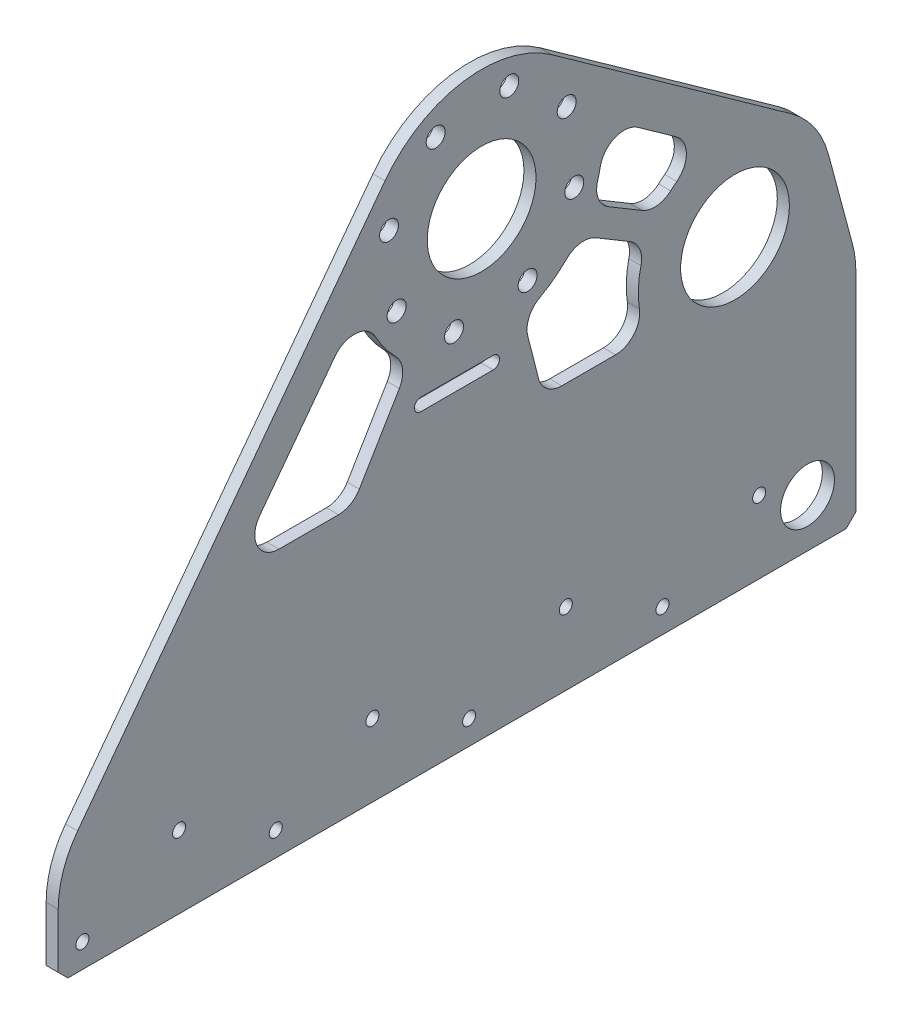
from build123d import *

# Parameters (mm, degrees)
SKETCH1_R                    = 14.2875
BOSS_EXTRUDE1_DEPTH          = 3.175
F_10_CLEARANCE_HOLE1_D       = 4.9784
SKETCH9_R                    = 7.0739
CUT_EXTRUDE1_DEPTH           = 246.051592782
FILLET1_R                    = 6.35
F_1_8_0_135_DIAMETER_HOLE1_D = 3.429
CHAMFER1_SIZE                = 2.54
CUT_EXTRUDE2_DEPTH           = 246.051592782


with BuildPart() as part:
    # Sketch1 → Boss-Extrude1 (new body)
    with BuildSketch(Plane(origin=(0, 0, 0), x_dir=(0, 0, -1), z_dir=(1, 0, 0))):
        with BuildLine():
            Line((0, -25.4), (0, 31.863977372))
            ThreePointArc((0, 31.863977372), (-0.217300521, 35.179342654), (-0.865484012, 38.437981118))
            Line((-0.865484012, 38.437981118), (-7.215484012, 62.136503746))
            ThreePointArc((-7.215484012, 62.136503746), (-10.879443925, 70.039374287), (-16.998077198, 76.239559115))
            Line((-16.998077198, 76.239559115), (-79.87164219, 121.096323894))
            ThreePointArc((-79.87164219, 121.096323894), (-103.165558841, 126.626759813), (-123.699445398, 114.31612306))
            Line((-123.699445398, 114.31612306), (-204.460319765, 6.777271443))
            ThreePointArc((-204.460319765, 6.777271443), (-208.244004669, -0.435792492), (-209.55, -8.475627004))
            Line((-209.55, -8.475627004), (-209.55, -25.4))
            Line((-209.55, -25.4), (0, -25.4))
        make_face()
        with Locations((-31.75, 55.5625)):
            Circle(SKETCH1_R, mode=Mode.SUBTRACT)
        with Locations((-98.311545692, 95.25)):
            Circle(SKETCH1_R, mode=Mode.SUBTRACT)
    extrude(amount=BOSS_EXTRUDE1_DEPTH)

    # #10 Clearance Hole1 (through all)
    with Locations(Plane(origin=(3.175, 0, 0), x_dir=(0, 0, -1), z_dir=(1, 0, 0))):
        with Locations((-91.050282965, 119.589968439), (-75.966100841, 107.326468623), (-73.971577253, 87.988737273), (-86.235077069, 72.904555149), (-105.572808419, 70.910031561), (-120.656990543, 83.173531377), (-122.651514131, 102.511262727), (-110.388014315, 117.595444851)):
            Hole(F_10_CLEARANCE_HOLE1_D / 2)

    # Sketch9 → Cut-Extrude1 (cut, through all)
    with BuildSketch(Plane(origin=(3.175, 0, 0), x_dir=(0, 0, -1), z_dir=(1, 0, 0))):
        with Locations((-12.7, -12.7)):
            Circle(SKETCH9_R)
        with BuildLine():
            Line((-164.256457276, 44.45), (-129.69901081, 90.465699272))
            ThreePointArc((-129.69901081, 90.465699272), (-125.509192978, 78.868593403), (-117.217117013, 69.742317372))
            Line((-117.217117013, 69.742317372), (-132.297729028, 44.45))
            Line((-132.297729028, 44.45), (-164.256457276, 44.45))
        make_face()
        with BuildLine():
            Line((-66.945646017, 100.173701616), (-38.671072347, 80.001377993))
            ThreePointArc((-38.671072347, 80.001377993), (-45.921454308, 76.641633825), (-51.769190034, 71.195542903))
            Line((-51.769190034, 71.195542903), (-69.551855526, 81.798504859))
            ThreePointArc((-69.551855526, 81.798504859), (-66.876157951, 90.791424263), (-66.945646017, 100.173701616))
        make_face()
        with BuildLine():
            Line((-55.021197572, 65.741466723), (-72.803863064, 76.344428679))
            ThreePointArc((-72.803863064, 76.344428679), (-79.339445973, 69.791761015), (-87.487017182, 65.402184627))
            Line((-87.487017182, 65.402184627), (-82.187487541, 44.45))
            Line((-82.187487541, 44.45), (-54.59014763, 44.45))
            ThreePointArc((-54.59014763, 44.45), (-57.144796276, 55.048377342), (-55.021197572, 65.741466723))
        make_face()
    extrude(amount=-CUT_EXTRUDE1_DEPTH, mode=Mode.SUBTRACT)

    # Fillet1
    fillet1_edges = [part.edges().sort_by_distance(p)[0] for p in [
        (1.5875, 100.173701616, 66.945646017),
        (1.5875, 71.195542903, 51.769190034),
        (1.5875, 81.798504859, 69.551855526),
        (1.5875, 80.001377993, 38.671072347),
        (1.5875, 76.344428679, 72.803863064),
        (1.5875, 65.741466723, 55.021197572),
        (1.5875, 44.45, 82.187487541),
        (1.5875, 65.402184627, 87.487017182),
        (1.5875, 44.45, 54.59014763),
        (1.5875, 44.45, 164.256457276),
        (1.5875, 90.465699272, 129.69901081),
        (1.5875, 69.742317372, 117.217117013),
        (1.5875, 44.45, 132.297729028),
    ]]
    fillet(fillet1_edges, radius=FILLET1_R)

    # 1/8 (0.135) Diameter Hole1 (through all)
    with Locations(Plane(origin=(3.175, 0, 0), x_dir=(0, 0, -1), z_dir=(1, 0, 0))):
        with Locations((-177.8, -6.35), (-152.4, -19.05), (-127, -6.35), (-101.6, -19.05), (-76.2, -6.35), (-50.8, -19.05), (-25.4, -6.35), (-203.2, -19.05)):
            Hole(F_1_8_0_135_DIAMETER_HOLE1_D / 2)

    # Chamfer1
    chamfer1_edges = [part.edges().sort_by_distance(p)[0] for p in [
        (1.5875, -25.4, 0),
        (1.5875, -25.4, 209.55),
    ]]
    chamfer(chamfer1_edges, length=CHAMFER1_SIZE)

    # Sketch12 → Cut-Extrude2 (cut, through all)
    with BuildSketch(Plane(origin=(3.175, 0, 0), x_dir=(0, 0, -1), z_dir=(1, 0, 0))):
        with BuildLine():
            Line((-114.315028797, 60.3885), (-95.265028797, 60.3885))
            ThreePointArc((-95.265028797, 60.3885), (-93.614028797, 58.7375), (-95.265028797, 57.0865))
            Line((-95.265028797, 57.0865), (-114.315028797, 57.0865))
            ThreePointArc((-114.315028797, 57.0865), (-115.966028797, 58.7375), (-114.315028797, 60.3885))
        make_face()
    extrude(amount=-CUT_EXTRUDE2_DEPTH, mode=Mode.SUBTRACT)


solid = part.part
